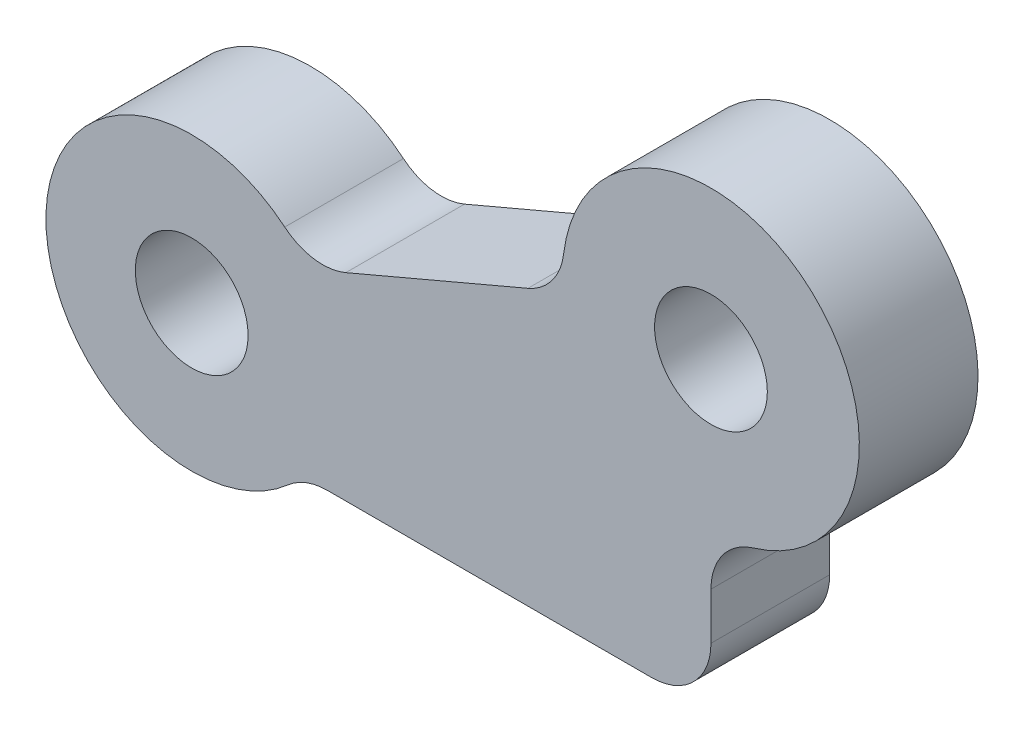
from build123d import *

# Parameters (mm, degrees)
SKETCH1_R           = 1.9
BOSS_EXTRUDE1_DEPTH = 4
FILLET1_R           = 2


with BuildPart() as part:
    # Sketch1 → Boss-Extrude1 (new body)
    with BuildSketch(Plane.XY):
        with BuildLine():
            Line((56.839071038, 28.579919803), (56.839071038, 23.292312115))
            Line((56.839071038, 23.292312115), (43.08257304, 23.292312115))
            ThreePointArc((43.08257304, 23.292312115), (34.429928081, 26.628647856), (43.273147001, 29.420937259))
            Line((43.273147001, 29.420937259), (51.8645252, 33.076041142))
            ThreePointArc((51.8645252, 33.076041142), (60.191727201, 37.289326312), (56.839071038, 28.579919803))
        make_face()
        with Locations((39.340592987, 26.475947236)):
            Circle(SKETCH1_R, mode=Mode.SUBTRACT)
        with Locations((56.839071038, 33.579919803)):
            Circle(SKETCH1_R, mode=Mode.SUBTRACT)
    extrude(amount=BOSS_EXTRUDE1_DEPTH)

    # Fillet1
    fillet1_edges = [part.edges().sort_by_distance(p)[0] for p in [
        (43.08257304, 23.292312115, 2),
        (56.839071038, 23.292312115, 2),
        (56.839071038, 28.579919803, 2),
        (43.273147001, 29.420937259, 2),
        (51.8645252, 33.076041142, 2),
    ]]
    fillet(fillet1_edges, radius=FILLET1_R)


solid = part.part
